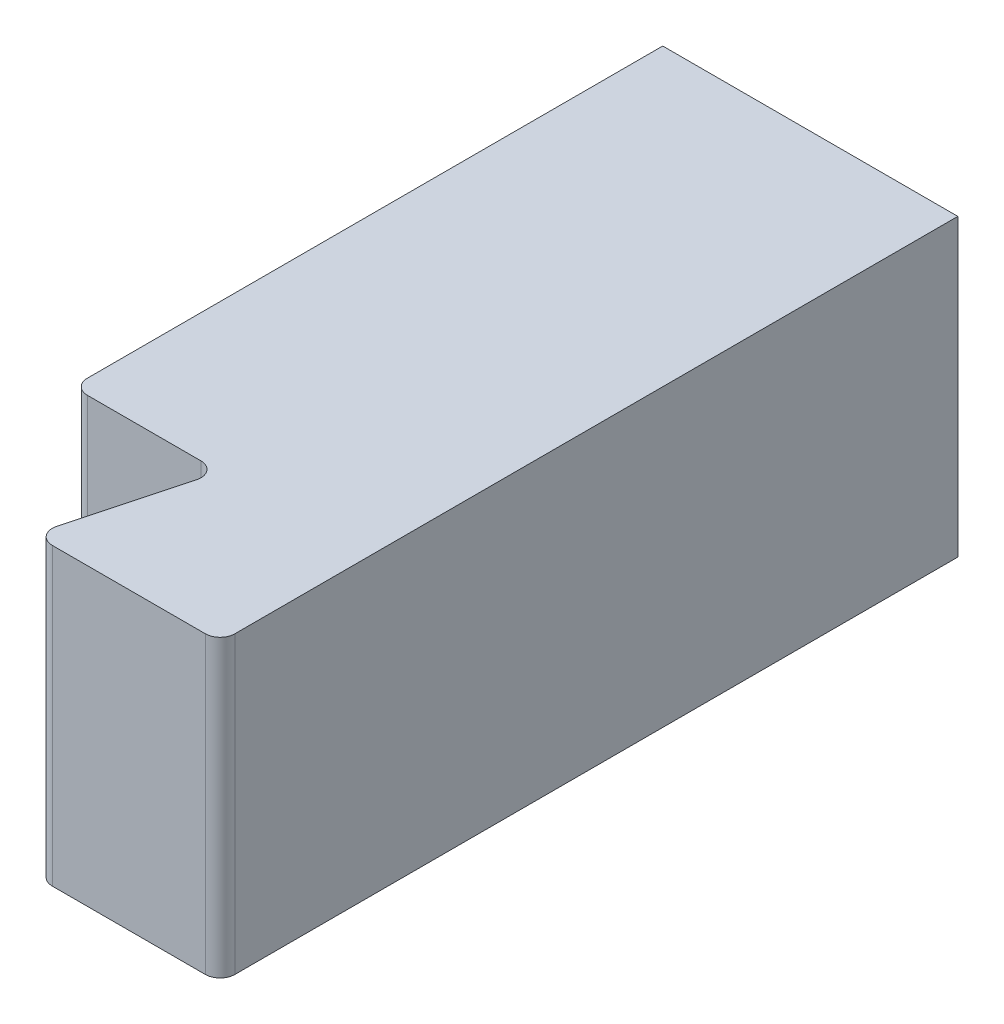
from build123d import *

# Parameters (mm, degrees)
LENGTH_EXTRUDE_DEPTH  = 5
EDGE_FILLETS_R        = 0.5
MAGNET_SLOT_CUT_DEPTH = 2


with BuildPart() as part:
    # Profile Sketch → Length Extrude (new, symmetric)
    with BuildSketch(Plane(origin=(-14.334694081, 0, -24.670133811), x_dir=(-1, 0, 0), z_dir=(0, 1, 0))):
        Polygon((5, 20), (5, 0), (-5, 0), (-5, 25), (1.339745962, 25), (0, 20), align=None)
    extrude(amount=LENGTH_EXTRUDE_DEPTH, both=True)

    # Edge Fillets
    edge_fillets_edges = [part.edges().sort_by_distance(p)[0] for p in [
        (-15.674440043, 0, 0.329866189),
        (-14.334694081, 0, -4.670133811),
        (-9.334694081, 0, 0.329866189),
        (-19.334694081, 0, -4.670133811),
    ]]
    fillet(edge_fillets_edges, radius=EDGE_FILLETS_R)

    # Magneet Slot Sketch → Magnet Slot Cut (cut)
    with BuildSketch(Plane(origin=(0, 0, -24.670133811), x_dir=(-1, 0, 0), z_dir=(0, 0, -1))):
        with BuildLine():
            Line((14.70944331, -3.207559389), (14.559669744, -3.081884445))
            ThreePointArc((14.559669744, -3.081884445), (14.334694081, -3), (14.109718417, -3.081884445))
            Line((14.109718417, -3.081884445), (13.959944851, -3.207559389))
            ThreePointArc((13.959944851, -3.207559389), (13.8210293, -3.278698395), (13.665001284, -3.282378948))
            ThreePointArc((13.665001284, -3.282378948), (12.659694081, -2.901185103), (11.826916925, -2.221160449))
            ThreePointArc((11.826916925, -2.221160449), (11.75209037, -2.084195946), (11.74424078, -1.928322047))
            Line((11.74424078, -1.928322047), (11.778191691, -1.735776862))
            ThreePointArc((11.778191691, -1.735776862), (11.736617869, -1.5), (11.553216028, -1.346107583))
            Line((11.553216028, -1.346107583), (11.369491551, -1.279237342))
            ThreePointArc((11.369491551, -1.279237342), (11.238425589, -1.194502448), (11.157224128, -1.061218499))
            ThreePointArc((11.157224128, -1.061218499), (10.984694081, 0), (11.157224128, 1.061218499))
            ThreePointArc((11.157224128, 1.061218499), (11.238425589, 1.194502448), (11.369491551, 1.279237342))
            Line((11.369491551, 1.279237342), (11.553216028, 1.346107583))
            ThreePointArc((11.553216028, 1.346107583), (11.736617869, 1.5), (11.778191691, 1.735776862))
            Line((11.778191691, 1.735776862), (11.74424078, 1.928322047))
            ThreePointArc((11.74424078, 1.928322047), (11.75209037, 2.084195946), (11.826916925, 2.221160449))
            ThreePointArc((11.826916925, 2.221160449), (12.659694081, 2.901185103), (13.665001284, 3.282378948))
            ThreePointArc((13.665001284, 3.282378948), (13.8210293, 3.278698395), (13.959944851, 3.207559389))
            Line((13.959944851, 3.207559389), (14.109718417, 3.081884445))
            ThreePointArc((14.109718417, 3.081884445), (14.334694081, 3), (14.559669744, 3.081884445))
            Line((14.559669744, 3.081884445), (14.70944331, 3.207559389))
            ThreePointArc((14.70944331, 3.207559389), (14.848358861, 3.278698395), (15.004386878, 3.282378948))
            ThreePointArc((15.004386878, 3.282378948), (16.009694081, 2.901185103), (16.842471236, 2.221160449))
            ThreePointArc((16.842471236, 2.221160449), (16.917297792, 2.084195946), (16.925147381, 1.928322047))
            Line((16.925147381, 1.928322047), (16.89119647, 1.735776862))
            ThreePointArc((16.89119647, 1.735776862), (16.932770292, 1.5), (17.116172133, 1.346107583))
            Line((17.116172133, 1.346107583), (17.29989661, 1.279237342))
            ThreePointArc((17.29989661, 1.279237342), (17.430962572, 1.194502448), (17.512164033, 1.061218499))
            ThreePointArc((17.512164033, 1.061218499), (17.684694081, 0), (17.512164033, -1.061218499))
            ThreePointArc((17.512164033, -1.061218499), (17.430962572, -1.194502448), (17.29989661, -1.279237342))
            Line((17.29989661, -1.279237342), (17.116172133, -1.346107583))
            ThreePointArc((17.116172133, -1.346107583), (16.932770292, -1.5), (16.89119647, -1.735776862))
            Line((16.89119647, -1.735776862), (16.925147381, -1.928322047))
            ThreePointArc((16.925147381, -1.928322047), (16.917297792, -2.084195946), (16.842471236, -2.221160449))
            ThreePointArc((16.842471236, -2.221160449), (16.009694081, -2.901185103), (15.004386878, -3.282378948))
            ThreePointArc((15.004386878, -3.282378948), (14.848358861, -3.278698395), (14.70944331, -3.207559389))
        make_face()
    extrude(amount=-MAGNET_SLOT_CUT_DEPTH, mode=Mode.SUBTRACT)


solid = part.part
